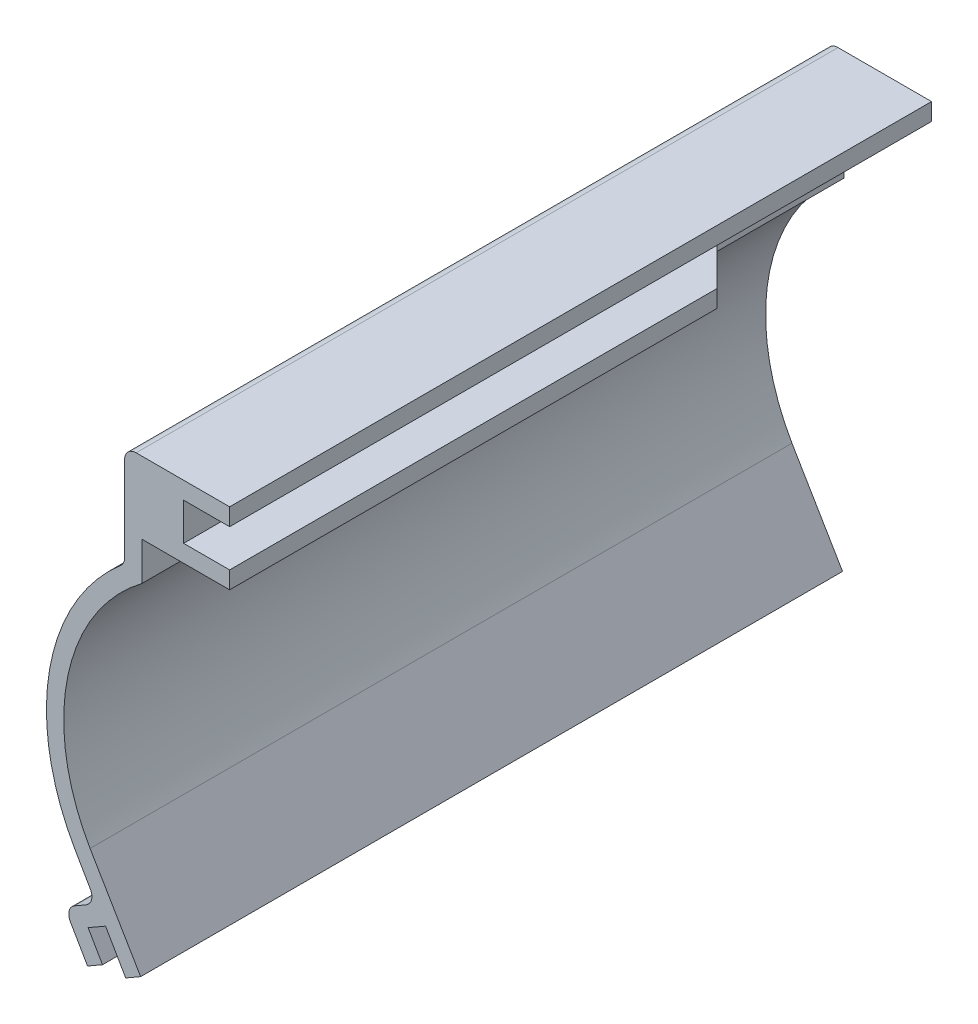
from build123d import *

# Parameters (mm, degrees)
BOSS_EXTRUDE1_DEPTH = 122
BOSS_EXTRUDE2_DEPTH = 80
CHAMFER2_SIZE       = 20


with BuildPart() as part:
    # Sketch1 → Boss-Extrude1 (new body)
    with BuildSketch(Plane.XY):
        with BuildLine():
            Line((-24.448977817, 50.585997889), (-24.448977817, 47.607417283))
            Line((-24.448977817, 47.607417283), (-31.698977817, 47.607417283))
            Line((-31.698977817, 47.607417283), (-31.698977817, 34.416624517))
            ThreePointArc((-31.698977817, 34.416624517), (-44.606827003, 13.925447751), (-40.708122297, -9.976455887))
            Line((-40.708122297, -9.976455887), (-31.917393168, -24.877445372))
            Line((-31.917393168, -24.877445372), (-34.51546938, -26.377445372))
            Line((-34.51546938, -26.377445372), (-38.01546938, -20.315267546))
            Line((-38.01546938, -20.315267546), (-41.046558293, -22.065267546))
            Line((-41.046558293, -22.065267546), (-38.546558293, -26.395394565))
            Line((-38.546558293, -26.395394565), (-41.144634504, -27.895394565))
            Line((-41.144634504, -27.895394565), (-44.144634504, -22.699242142))
            ThreePointArc((-44.144634504, -22.699242142), (-44.344435349, -21.181604052), (-43.412583697, -19.967191335))
            Line((-43.412583697, -19.967191335), (-41.388249315, -18.798441335))
            ThreePointArc((-41.388249315, -18.798441335), (-40.456397663, -17.584028617), (-40.656198508, -16.066390527))
            Line((-40.656198508, -16.066390527), (-43.306198508, -11.476455887))
            ThreePointArc((-43.306198508, -11.476455887), (-47.768566234, 13.330532327), (-35.392400045, 35.287988929))
            ThreePointArc((-35.392400045, 35.287988929), (-34.880578034, 35.969486614), (-34.698977817, 36.802206392))
            Line((-34.698977817, 36.802206392), (-34.698977817, 51.585997889))
            ThreePointArc((-34.698977817, 51.585997889), (-34.113191379, 53.000211451), (-32.698977817, 53.585997889))
            Line((-32.698977817, 53.585997889), (-16.448977817, 53.585997889))
            Line((-16.448977817, 53.585997889), (-16.448977817, 50.585997889))
            Line((-16.448977817, 50.585997889), (-24.448977817, 50.585997889))
        make_face()
    extrude(amount=BOSS_EXTRUDE1_DEPTH)

    # Sketch3 → Boss-Extrude2 (add)
    with BuildSketch(Plane.XY.offset(122)):
        Polygon((-31.698977817, 41.085997889), (-16.448977817, 41.085997889), (-16.448977817, 44.085997889), (-24.448977817, 44.085997889), (-24.448977817, 47.607417283), (-31.698977817, 47.607417283), align=None)
    extrude(amount=-BOSS_EXTRUDE2_DEPTH)

    # Chamfer2
    # the kernel refuses this chamfer: 20 mm, written as the material it adds along each edge
    with BuildSketch(Plane(origin=(-31.698977817, 47.607417283, 42), x_dir=(-0.02749587661058649, 0, -0.9996219169112968), z_dir=(0, -1, 0))) as chamfer2_piece_1_section:
        Polygon((CHAMFER2_SIZE * 0.999621916911, CHAMFER2_SIZE * 0.0274958766106), (-CHAMFER2_SIZE * 0.0274958766106, CHAMFER2_SIZE * 0.999621916911), (0, 0), align=None)
    chamfer2_piece_1 = extrude(amount=6.521419395, mode=Mode.PRIVATE)
    chamfer2_piece_1 = split(chamfer2_piece_1, bisect_by=Plane(origin=(-24.448977817, 45.846707586, 33.55788947), z_dir=(-1, 0, 0)), keep=Keep.TOP, mode=Mode.PRIVATE)
    chamfer2_piece_1 = split(chamfer2_piece_1, bisect_by=Plane(origin=(-28.61775968, 44.085997889, 33.55788947), z_dir=(0, 1, 0)), keep=Keep.TOP, mode=Mode.PRIVATE)
    add(chamfer2_piece_1)
    with BuildSketch(Plane(origin=(-31.698977817, 47.607417283, 42), x_dir=(-0.02749587661058649, 0, -0.9996219169112968), z_dir=(0, -1, 0))) as chamfer2_piece_2_section:
        Polygon((CHAMFER2_SIZE * 0.999621916911, CHAMFER2_SIZE * 0.0274958766106), (-CHAMFER2_SIZE * 0.0274958766106, CHAMFER2_SIZE * 0.999621916911), (0, 0), align=None)
    chamfer2_piece_2 = extrude(amount=6.521419395, mode=Mode.PRIVATE)
    chamfer2_piece_2 = split(chamfer2_piece_2, bisect_by=Plane(origin=(-24.448977817, 42.585997889, 33.55788947), z_dir=(-1, 0, 0)), keep=Keep.TOP, mode=Mode.PRIVATE)
    chamfer2_piece_2 = split(chamfer2_piece_2, bisect_by=Plane(origin=(-28.61775968, 44.085997889, 33.55788947), z_dir=(0, -1, 0)), keep=Keep.TOP, mode=Mode.PRIVATE)
    add(chamfer2_piece_2)
    with BuildSketch(Plane(origin=(-31.698977817, 47.607417283, 42), x_dir=(-0.02749587661058649, 0, -0.9996219169112968), z_dir=(0, -1, 0))) as chamfer2_piece_3_section:
        Polygon((CHAMFER2_SIZE * 0.999621916911, CHAMFER2_SIZE * 0.0274958766106), (-CHAMFER2_SIZE * 0.0274958766106, CHAMFER2_SIZE * 0.999621916911), (0, 0), align=None)
    chamfer2_piece_3 = extrude(amount=6.521419395, mode=Mode.PRIVATE)
    chamfer2_piece_3 = split(chamfer2_piece_3, bisect_by=Plane(origin=(-24.448977817, 42.585997889, 37.556915733), z_dir=(1, 0, 0)), keep=Keep.TOP, mode=Mode.PRIVATE)
    chamfer2_piece_3 = split(chamfer2_piece_3, bisect_by=Plane(origin=(-16.448977817, 42.585997889, 37.556915733), z_dir=(-1, 0, 0)), keep=Keep.TOP, mode=Mode.PRIVATE)
    chamfer2_piece_3 = split(chamfer2_piece_3, bisect_by=Plane(origin=(-21.010172904, 44.085997889, 37.556915733), z_dir=(0, -1, 0)), keep=Keep.TOP, mode=Mode.PRIVATE)
    add(chamfer2_piece_3)


solid = part.part
